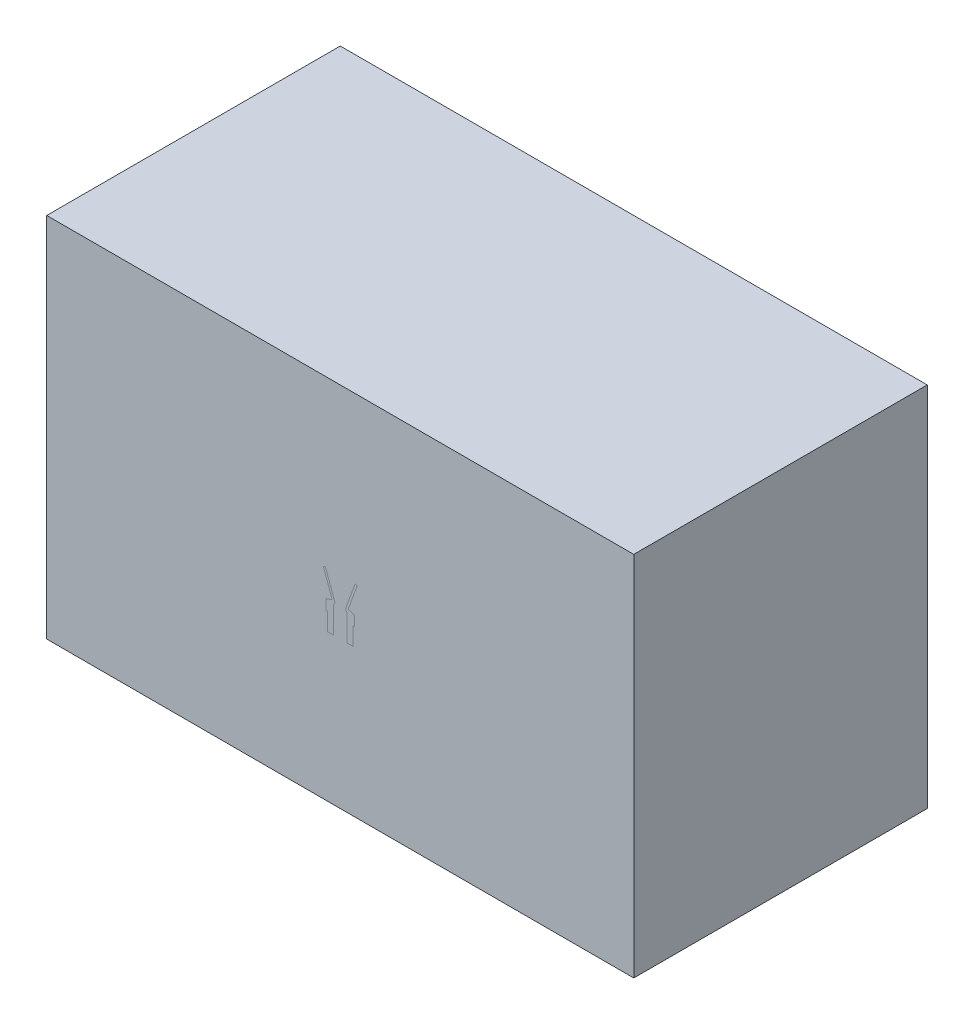
from build123d import *

# Parameters (mm, degrees)
SKETCH1_R           = 220.65
SKETCH1_R_2         = 120.65
BOSS_EXTRUDE1_DEPTH = 457
FILLET1_R           = 50.8
FILLET2_R           = 12.7
SKETCH3_W           = 10160
SKETCH3_H           = 6350
BOSS_EXTRUDE2_DEPTH = 5080
SKETCH4_W           = 13475.768327993
SKETCH4_H           = 8367.586519284
CUT_EXTRUDE1_DEPTH  = 8132.96778154


# Read off the part's stored shape, not the designer's step: Intersect1
with BuildPart() as part:
    # Sketch1 → Boss-Extrude1 (new body)
    with BuildSketch(Plane(origin=(0, 0, 0), x_dir=(1, 0, 0), z_dir=(0, 1, 0))):
        with Locations(Location((0, 0, 0), (0, 0, 270))):
            Circle(SKETCH1_R)
        with Locations(Location((0, 0, 0), (0, 0, 270))):
            Circle(SKETCH1_R_2, mode=Mode.SUBTRACT)
    extrude(amount=BOSS_EXTRUDE1_DEPTH)

    # Sketch2 → Revolve1 (revolve)
    with BuildSketch(Plane.XY, mode=Mode.PRIVATE) as revolve1_sk:
        Polygon((-220.65, 307), (-246.05, 307), (-246.05, 482.4), (-138.974740497, 521.372207285), (-293.235833302, 945.201076466), (-257.43354445, 958.232043927), (-101.061934921, 528.604577704), (-75, 457), (-220.65, 457), align=None)
    revolve(revolve1_sk.sketch.rotate(Axis((0, 0, 0), (0, 1, 0)), 270), axis=Axis((0, 0, 0), (0, 1, 0)))

    # Fillet1
    # the kernel refuses this fillet: 50.8 mm, written as the material it takes off along each edge
    with BuildSketch(Plane(origin=(0, 457, 0), x_dir=(0, 0, -1), z_dir=(1, 0, 0))) as fillet1_piece_1:
        with BuildLine():
            CenterArc((145.239501631, 44.452181156), FILLET1_R, 160, 81.050057514)
            Line((120.65, 0), (120.158209967, -0.889043623))
            ThreePointArc((120.158209967, -0.889043623), (97.825, -1.016), (75, -1.016))
            Line((75, -1.016), (74.045272297, 0.347492466))
            Line((74.045272297, 0.347492466), (96.548388792, 62.174296903))
            Line((96.548388792, 62.174296903), (97.503116495, 61.826804437))
        make_face()
    revolve(axis=Axis((0, 457, 0), (0, 1, 0)), mode=Mode.SUBTRACT)

    # Fillet2
    fillet2_edges = [part.edges().sort_by_distance(p)[0] for p in [
        (0, 945.201076466, 293.235833302),
        (0, 958.232043927, 257.43354445),
    ]]
    fillet(fillet2_edges, radius=FILLET2_R)


with BuildPart() as body_2:
    # Sketch3 → Boss-Extrude2 (new, symmetric)
    with BuildSketch(Plane(origin=(0, 0, 0), x_dir=(0, 0, -1), z_dir=(1, 0, 0))):
        with Locations((0, 635)):
            Rectangle(SKETCH3_W, SKETCH3_H)
    extrude(amount=BOSS_EXTRUDE2_DEPTH, both=True)

    # Intersect1 outline → Intersect1 (revolve, cut)
    with BuildSketch(Plane.XY):
        with BuildLine():
            Line((281.301737018, 949.544732287), (269.367640734, 953.888388107))
            ThreePointArc((269.367640734, 953.888388107), (259.65673299, 953.464400718), (253.08988863, 946.297947643))
            Line((253.08988863, 946.297947643), (97.503116495, 518.826804437))
            ThreePointArc((97.503116495, 518.826804437), (97.664330471, 483.640862027), (120.65, 457))
            Line((120.65, 457), (120.65, 0))
            Line((120.65, 0), (220.65, 0))
            Line((220.65, 0), (220.65, 307))
            Line((220.65, 307), (246.05, 307))
            Line((246.05, 307), (246.05, 482.4))
            Line((246.05, 482.4), (138.974740497, 521.372207285))
            Line((138.974740497, 521.372207285), (288.892177482, 933.266980183))
            ThreePointArc((288.892177482, 933.266980183), (288.468190093, 942.977887927), (281.301737018, 949.544732287))
        make_face()
    revolve(axis=Axis((0, 0, 0), (0, 1, 0)), mode=Mode.SUBTRACT)


with BuildPart() as cut_extrude1_tool:
    # Sketch4 → Cut-Extrude1 (new, through all)
    with BuildSketch(Plane.XY):
        with Locations((454.179344916, 464.014834855)):
            Rectangle(SKETCH4_W, SKETCH4_H)
    extrude(amount=CUT_EXTRUDE1_DEPTH)


with BuildPart() as part_1:
    add(part.part)

    # Cut-Extrude1: cut by cut_extrude1_tool
    add(cut_extrude1_tool.part, mode=Mode.SUBTRACT)


with BuildPart() as body_2_1:
    add(body_2.part)

    # Cut-Extrude1: cut by cut_extrude1_tool
    add(cut_extrude1_tool.part, mode=Mode.SUBTRACT)


solid = Compound([part_1.part, body_2_1.part])
